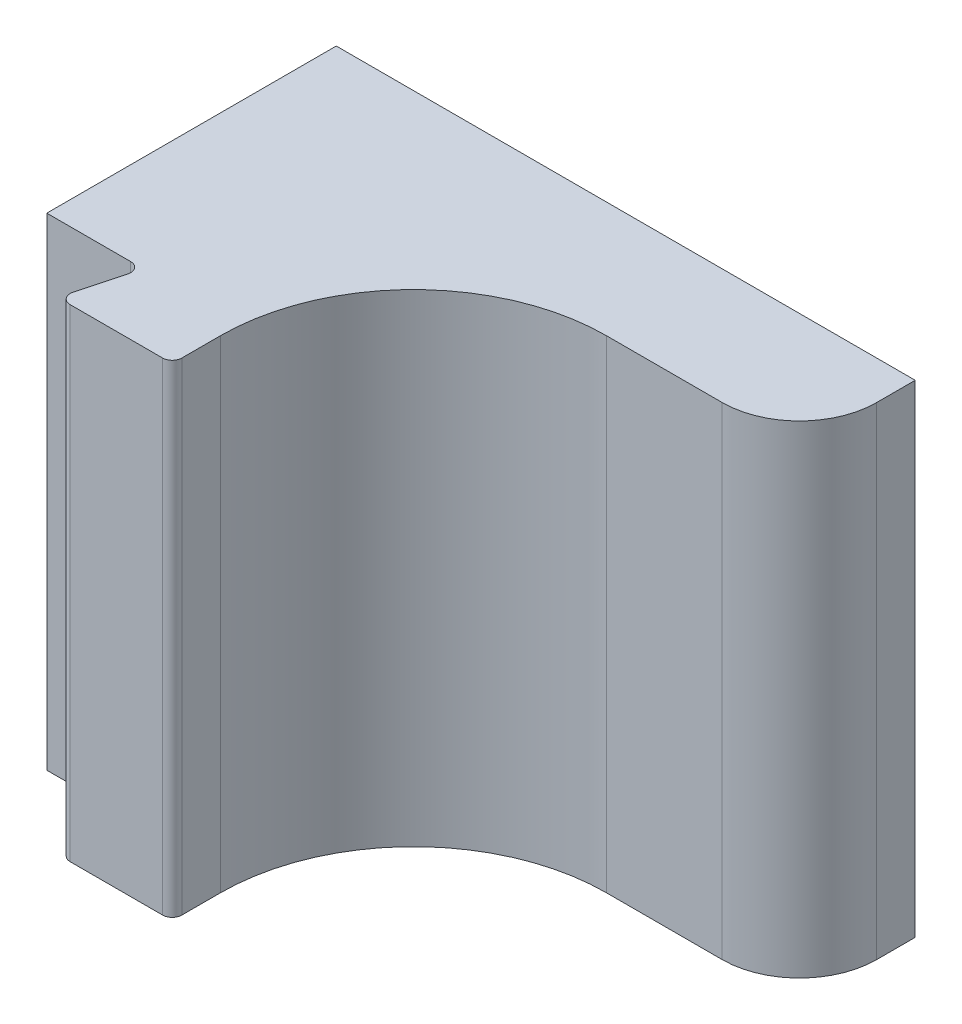
from build123d import *

# Parameters (mm, degrees)
LENGTH_EXTRUDE_DEPTH                          = 12.5
EDGE_FILLETS_R                                = 0.5
BASE_FILLET_R                                 = 4
TRANSITION_FILLET_R                           = 10
MAGNET_SLOT_CUT_DEPTH                         = 4
MAGNET_SLOT_CHAMFER_SIZE                      = 0.475
MAGNET_SLOT_CHAMFER_OF_MAGNET_HOLE_MIRRO_SIZE = 0.475


with BuildPart() as part:
    # Profile Sketch → Length Extrude (new, symmetric)
    with BuildSketch(Plane(origin=(-14.334694081, 0, -24.670133811), x_dir=(-1, 0, 0), z_dir=(0, 1, 0))):
        Polygon((0.665305919, 24.670133811), (-29.334694081, 24.670133811), (-29.334694081, 30.670133811), (-9.334694081, 30.670133811), (-9.334694081, 43.170133811), (-3.396871907, 43.170133811), (-4.334694081, 39.670133811), (0.665305919, 39.670133811), align=None)
    extrude(amount=LENGTH_EXTRUDE_DEPTH, both=True)

    # Edge Fillets
    edge_fillets_edges = [part.edges().sort_by_distance(p)[0] for p in [
        (-10.937822174, 0, 18.5),
        (-10, 0, 15),
        (-5, 0, 18.5),
    ]]
    fillet(edge_fillets_edges, radius=EDGE_FILLETS_R)

    # Base Fillet
    base_fillet_edges = [part.edges().sort_by_distance(p)[0] for p in [
        (15, 0, 6),
    ]]
    fillet(base_fillet_edges, radius=BASE_FILLET_R)

    # Transition Fillet
    transition_fillet_edges = [part.edges().sort_by_distance(p)[0] for p in [
        (-5, 0, 6),
    ]]
    fillet(transition_fillet_edges, radius=TRANSITION_FILLET_R)

    # Magnet Slot Sketch → Magnet Slot Cut (cut)
    with BuildSketch(Plane(origin=(0, 0, 0), x_dir=(-1, 0, 0), z_dir=(0, 0, -1))):
        with BuildLine():
            Line((-7.386006886, -3.437391856), (-7.642832699, -3.009961925))
            ThreePointArc((-7.642832699, -3.009961925), (-8.5, -2.525), (-9.357167301, -3.009961925))
            Line((-9.357167301, -3.009961925), (-9.613993114, -3.437391856))
            ThreePointArc((-9.613993114, -3.437391856), (-10.254721707, -3.898649989), (-11.030354858, -3.751390315))
            ThreePointArc((-11.030354858, -3.751390315), (-11.159728267, -3.6608019), (-11.285861551, -3.565753836))
            ThreePointArc((-11.285861551, -3.565753836), (-11.665597649, -2.873588616), (-11.42491112, -2.12168291))
            Line((-11.42491112, -2.12168291), (-11.09776464, -1.745343934))
            ThreePointArc((-11.09776464, -1.745343934), (-10.901417704, -0.780267911), (-11.627523166, -0.11491484))
            Line((-11.627523166, -0.11491484), (-12.113396727, -0.00274209))
            ThreePointArc((-12.113396727, -0.00274209), (-12.750075305, 0.464090412), (-12.849706857, 1.247267116))
            ThreePointArc((-12.849706857, 1.247267116), (-12.803530736, 1.3983019), (-12.752111984, 1.547633248))
            ThreePointArc((-12.752111984, 1.547633248), (-12.211168649, 2.122674555), (-11.4216876, 2.126119704))
            Line((-11.4216876, 2.126119704), (-10.962674143, 1.931280052))
            ThreePointArc((-10.962674143, 1.931280052), (-9.984157762, 2.042767911), (-9.575748316, 2.938940648))
            Line((-9.575748316, 2.938940648), (-9.619208879, 3.435697151))
            ThreePointArc((-9.619208879, 3.435697151), (-9.371969286, 4.185473638), (-8.657911821, 4.522243786))
            ThreePointArc((-8.657911821, 4.522243786), (-8.5, 4.525), (-8.342088179, 4.522243786))
            ThreePointArc((-8.342088179, 4.522243786), (-7.628030714, 4.185473638), (-7.380791121, 3.435697151))
            Line((-7.380791121, 3.435697151), (-7.424251684, 2.938940648))
            ThreePointArc((-7.424251684, 2.938940648), (-7.015842238, 2.042767911), (-6.037325857, 1.931280052))
            Line((-6.037325857, 1.931280052), (-5.5783124, 2.126119704))
            ThreePointArc((-5.5783124, 2.126119704), (-4.788831351, 2.122674555), (-4.247888016, 1.547633248))
            ThreePointArc((-4.247888016, 1.547633248), (-4.196469264, 1.3983019), (-4.150293143, 1.247267116))
            ThreePointArc((-4.150293143, 1.247267116), (-4.249924695, 0.464090412), (-4.886603273, -0.00274209))
            Line((-4.886603273, -0.00274209), (-5.372476834, -0.11491484))
            ThreePointArc((-5.372476834, -0.11491484), (-6.098582296, -0.780267911), (-5.90223536, -1.745343934))
            Line((-5.90223536, -1.745343934), (-5.57508888, -2.12168291))
            ThreePointArc((-5.57508888, -2.12168291), (-5.334402351, -2.873588616), (-5.714138449, -3.565753836))
            ThreePointArc((-5.714138449, -3.565753836), (-5.840271733, -3.6608019), (-5.969645142, -3.751390315))
            ThreePointArc((-5.969645142, -3.751390315), (-6.745278293, -3.898649989), (-7.386006886, -3.437391856))
        make_face()
    magnet_slot_cut = extrude(amount=-MAGNET_SLOT_CUT_DEPTH, mode=Mode.SUBTRACT)

    # Magnet Slot Chamfer
    magnet_slot_chamfer_edges = [part.edges().sort_by_distance(p)[0] for p in [
        (7.402521402, 3.187318899, 0),
        (7.628030714, 4.185473638, 0),
        (7.015842238, 2.042767911, 0),
        (9.984157762, 2.042767911, 0),
        (11.192180871, 2.028699878, 0),
        (12.211168649, 2.122674555, 0),
        (10.901417704, -0.780267911, 0),
        (11.26133788, -1.933513422, 0),
        (11.665597649, -2.873588616, 0),
        (8.5, -2.525, 0),
        (6.745278293, -3.898649989, 0),
        (7.514419793, -3.223676891, 0),
        (4.249924695, 0.464090412, 0),
        (5.129540054, -0.058828465, 0),
        (6.098582296, -0.780267911, 0),
        (9.371969286, 4.185473638, 0),
        (9.597478598, 3.187318899, 0),
        (8.5, 4.525, 0),
        (12.803530736, 1.3983019, 0),
        (5.807819129, 2.028699878, 0),
        (12.750075305, 0.464090412, 0),
        (4.788831351, 2.122674555, 0),
        (11.870459946, -0.058828465, 0),
        (4.196469264, 1.3983019, 0),
        (11.159728267, -3.6608019, 0),
        (5.73866212, -1.933513422, 0),
        (10.254721707, -3.898649989, 0),
        (5.334402351, -2.873588616, 0),
        (9.485580207, -3.223676891, 0),
        (5.840271733, -3.6608019, 0),
    ]]
    chamfer(magnet_slot_chamfer_edges, length=MAGNET_SLOT_CHAMFER_SIZE)

    # Magnet Hole Mirror: Magnet Slot Cut across plane
    add(magnet_slot_cut.mirror(Plane(origin=(0, 0, 0), x_dir=(0, 0, 1), z_dir=(1, 0, 0))), mode=Mode.SUBTRACT)

    # Magnet Slot Chamfer of Magnet Hole Mirro
    magnet_slot_chamfer_of_magnet_hole_mirro_edges = [part.edges().sort_by_distance(p)[0] for p in [
        (-7.402521402, 3.187318899, 0),
        (-7.628030714, 4.185473638, 0),
        (-7.015842238, 2.042767911, 0),
        (-9.984157762, 2.042767911, 0),
        (-11.192180871, 2.028699878, 0),
        (-12.211168649, 2.122674555, 0),
        (-10.901417704, -0.780267911, 0),
        (-11.26133788, -1.933513422, 0),
        (-11.665597649, -2.873588616, 0),
        (-8.5, -2.525, 0),
        (-6.745278293, -3.898649989, 0),
        (-7.514419793, -3.223676891, 0),
        (-4.249924695, 0.464090412, 0),
        (-5.129540054, -0.058828465, 0),
        (-6.098582296, -0.780267911, 0),
        (-9.371969286, 4.185473638, 0),
        (-9.597478598, 3.187318899, 0),
        (-8.5, 4.525, 0),
        (-12.803530736, 1.3983019, 0),
        (-5.807819129, 2.028699878, 0),
        (-12.750075305, 0.464090412, 0),
        (-4.788831351, 2.122674555, 0),
        (-11.870459946, -0.058828465, 0),
        (-4.196469264, 1.3983019, 0),
        (-11.159728267, -3.6608019, 0),
        (-5.73866212, -1.933513422, 0),
        (-10.254721707, -3.898649989, 0),
        (-5.334402351, -2.873588616, 0),
        (-9.485580207, -3.223676891, 0),
        (-5.840271733, -3.6608019, 0),
    ]]
    chamfer(magnet_slot_chamfer_of_magnet_hole_mirro_edges, length=MAGNET_SLOT_CHAMFER_OF_MAGNET_HOLE_MIRRO_SIZE)


solid = part.part
